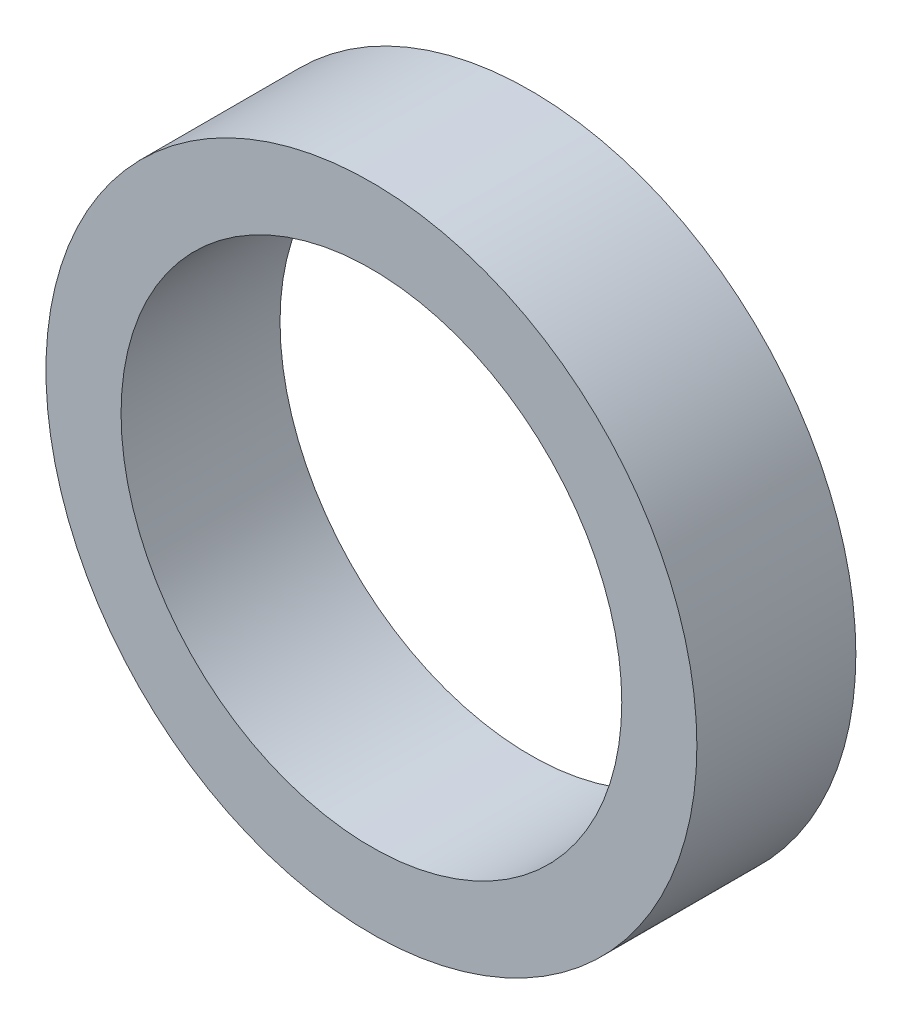
from build123d import *

# Parameters (mm, degrees)
SKETCH1_R      = 6.5
SKETCH1_R_2    = 5
EXTRUDE1_DEPTH = 1.5875


with BuildPart() as part:
    # Sketch1 → Extrude1 (new, symmetric)
    with BuildSketch(Plane.XY):
        Circle(SKETCH1_R)
        Circle(SKETCH1_R_2, mode=Mode.SUBTRACT)
    extrude(amount=EXTRUDE1_DEPTH, both=True)


solid = part.part
